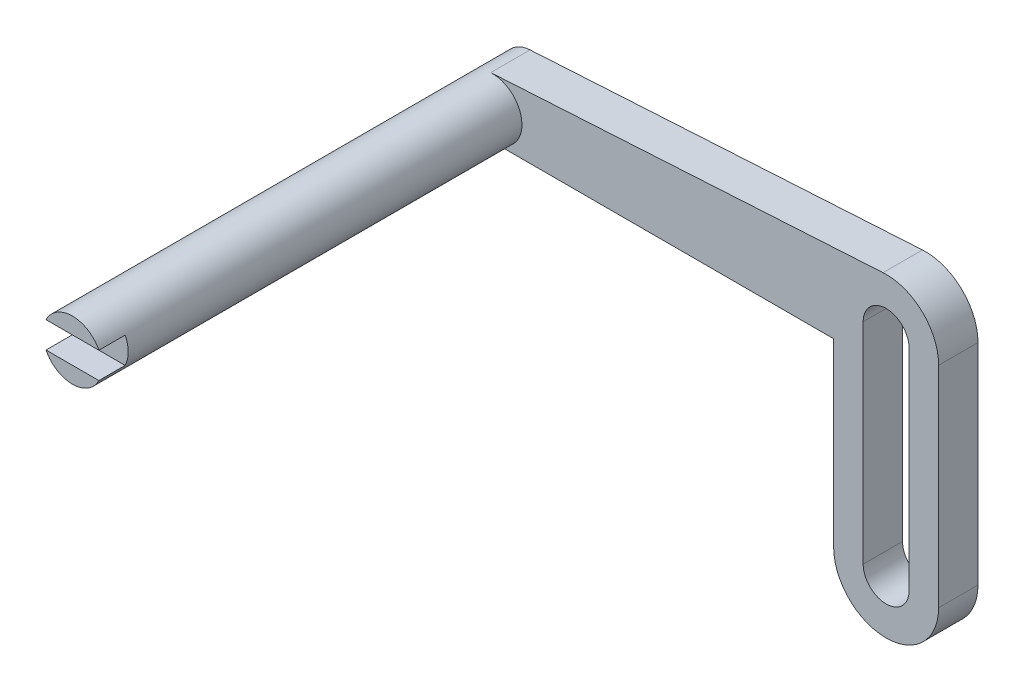
from build123d import *

# Parameters (mm, degrees)
EXTRUDE_1_DEPTH     = 3
SKETCH_1_3_R        = 2.25
EXTRUDE_2_DEPTH     = 35
SKETCH_2_W          = 5
SKETCH_2_H          = 2
CUT_EXTRUDE_1_DEPTH = 2
FILLET_1_R          = 4


with BuildPart() as part:
    # 草图1 → 凸台-拉伸1 (new body)
    with BuildSketch(Plane.XY):
        with BuildLine():
            Line((29.766666667, 3.993188645), (-0.13125, 2.246168613))
            ThreePointArc((-0.13125, 2.246168613), (-2.249041949, -0.065652955), (0, -2.25))
            Line((0, -2.25), (26, -2.25))
            Line((26, -2.25), (26, -20))
            Line((26, -20), (34, -20))
            Line((34, -20), (34, 0))
            ThreePointArc((34, 0), (32.744691847, 2.909753712), (29.766666667, 3.993188645))
        make_face()
        with BuildLine():
            Line((28.25, -16), (28.25, 0))
            ThreePointArc((28.25, 0), (30, 1.75), (31.75, 0))
            Line((31.75, 0), (31.75, -16))
            ThreePointArc((31.75, -16), (30, -17.75), (28.25, -16))
        make_face(mode=Mode.SUBTRACT)
    extrude(amount=EXTRUDE_1_DEPTH)

    # 草图1<3> → 凸台-拉伸2 (add)
    with BuildSketch(Plane.XY):
        with Locations(Location((0, 0, 0), (0, 0, 93.344152204))):
            Circle(SKETCH_1_3_R)
    extrude(amount=EXTRUDE_2_DEPTH)

    # 草图2 → 切除-拉伸1 (cut)
    with BuildSketch(Plane.XY.offset(35)):
        Rectangle(SKETCH_2_W, SKETCH_2_H)
    extrude(amount=-CUT_EXTRUDE_1_DEPTH, mode=Mode.SUBTRACT)

    # 圆角1
    fillet_1_edges = [part.edges().sort_by_distance(p)[0] for p in [
        (26, -20, 1.5),
        (34, -20, 1.5),
    ]]
    fillet(fillet_1_edges, radius=FILLET_1_R - 0.0001)  # a hair under: the kernel refuses the full size


solid = part.part
